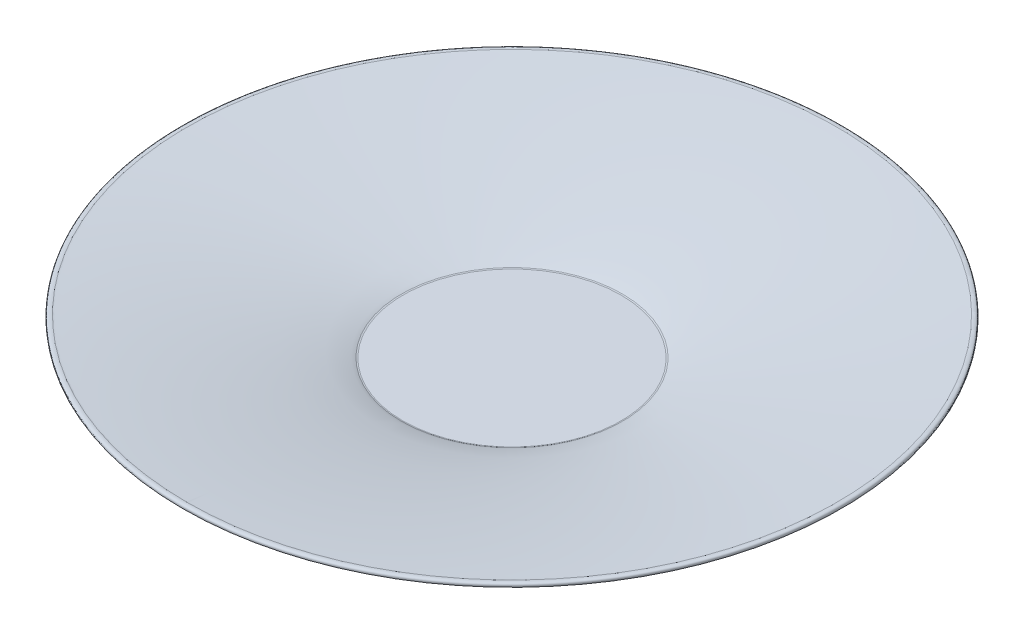
from build123d import *

# Parameters (mm, degrees)
SKETCH2_R           = 30
BOSS_EXTRUDE1_DEPTH = 2
FILLET1_R           = 3
FILLET3_R           = 0.75
FILLET4_R           = 0.65
SKETCH3_R           = 27
CUT_EXTRUDE1_DEPTH  = 1
FILLET6_R           = 0.65


with BuildPart() as part:
    # Sketch1 → Revolve1 (revolve)
    with BuildSketch(Plane.XY):
        with BuildLine():
            Line((0, 0), (25, 0))
            add(Edge.make_bspline(
                [(25, 0), (28, 1.560989968), (50, 6.358517879), (74, 8.46943016), (74, 8.533397199)],
                knots=[0, 0, 0, 0, 0, 1, 1, 1, 1, 1], degree=4))
            add(Edge.make_bspline(
                [(74, 8.533397199), (75.233494481, 8.736245364), (75, 7.797859499)],
                knots=[0, 0, 0, 1, 1, 1], degree=2))
            add(Edge.make_bspline(
                [(25.8, -2.376321587), (25, -1.188160793), (28.376743668, 0.582613407), (50.4, 4.566277202), (75, 7.797859499)],
                knots=[0, 0, 0, 0, 0, 1, 1, 1, 1, 1], degree=4))
            Line((25.8, -2.376321587), (0, -2.376321587))
            Line((0, -2.376321587), (0, 0))
        make_face()
    revolve(axis=Axis((0, 0, 0), (0, -1, 0)))

    # Sketch2 → Boss-Extrude1 (add)
    with BuildSketch(Plane.XZ.offset(2.376321587)):
        with Locations(Location((0, 0, 0), (0, 0, 270))):
            Circle(SKETCH2_R)
    extrude(amount=BOSS_EXTRUDE1_DEPTH)

    # Fillet1
    # the kernel refuses this fillet: 3 mm, written as the material it takes off along each edge
    with BuildSketch(Plane(origin=(0, -2.376321587, 0), x_dir=(0, 0, -1), z_dir=(-1, 0, 0))) as fillet1_piece_1:
        with BuildLine():
            CenterArc((27.171572875, 3), FILLET1_R, 270, 70.528779366)
            Line((27.171572875, 0), (27.171572875, -0.06))
            Line((27.171572875, -0.06), (30, -0.06))
            Line((30, -0.06), (30.06, 0))
            ThreePointArc((30.06, 0), (30.06, 1), (30.056568542, 1.98))
            Line((30.056568542, 1.98), (30, 2))
        make_face()
    revolve(axis=Axis((0, -2.376321587, 0), (0, -1, 0)), mode=Mode.SUBTRACT)

    # Fillet3
    fillet3_edges = [part.edges().sort_by_distance(p)[0] for p in [
        (-25, 0, 0),
    ]]
    fillet(fillet3_edges, radius=FILLET3_R)

    # Fillet4
    fillet4_edges = [part.edges().sort_by_distance(p)[0] for p in [
        (-25.8, -2.376321587, 0),
    ]]
    fillet(fillet4_edges, radius=FILLET4_R)

    # Sketch3 → Cut-Extrude1 (cut)
    with BuildSketch(Plane.XZ.offset(4.376321587)):
        with Locations(Location((0, 0, 0), (0, 0, 270))):
            Circle(SKETCH3_R)
    extrude(amount=-CUT_EXTRUDE1_DEPTH, mode=Mode.SUBTRACT)

    # Fillet6
    fillet6_edges = [part.edges().sort_by_distance(p)[0] for p in [
        (0, -3.376321587, 27),
    ]]
    fillet(fillet6_edges, radius=FILLET6_R)


solid = part.part
